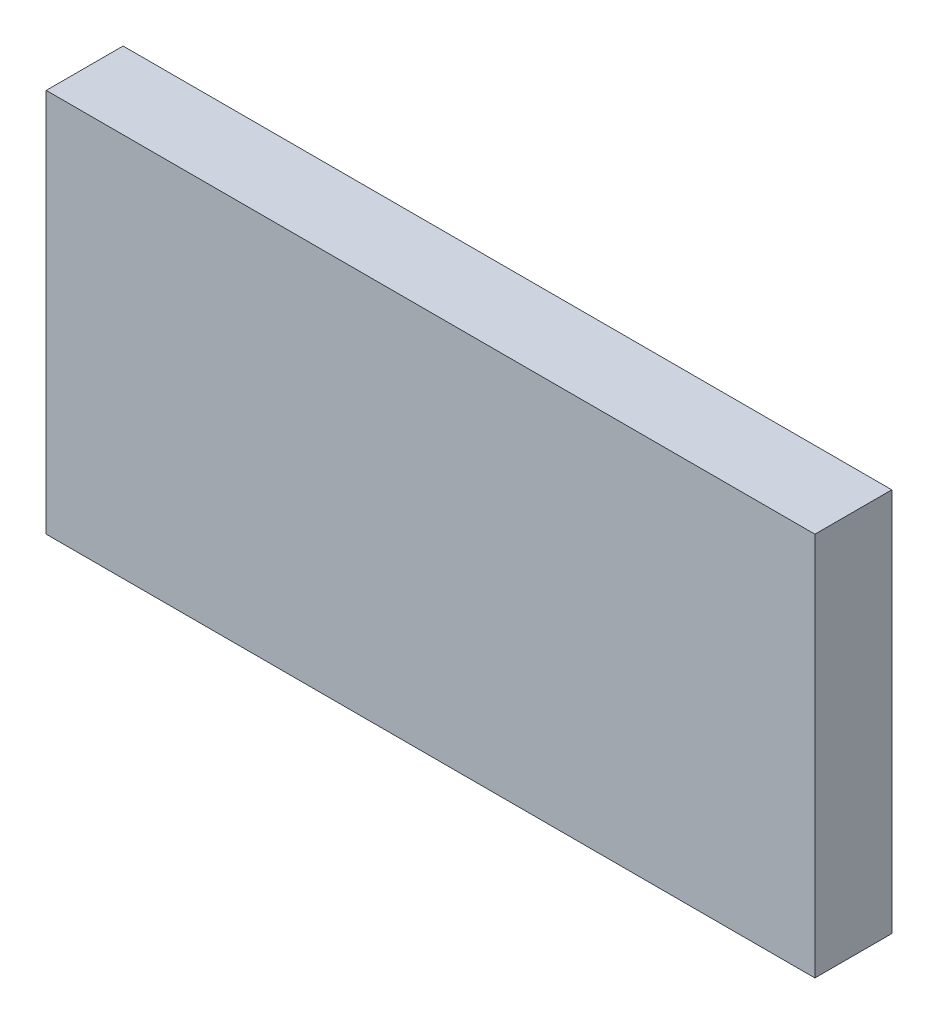
from build123d import *

# Parameters (mm, degrees)
SKETCH_1_W             = 20
SKETCH_1_H             = 10
SM_BASE_FLANGE_1_DEPTH = 2


# Sheet-metal steps are written as plain solids
with BuildPart() as part:
    # Sketch 1 → 基体-法兰1 (new body)
    with BuildSketch(Plane.XY):
        with Locations((10, 5)):
            Rectangle(SKETCH_1_W, SKETCH_1_H)
    extrude(amount=-SM_BASE_FLANGE_1_DEPTH)


solid = part.part
